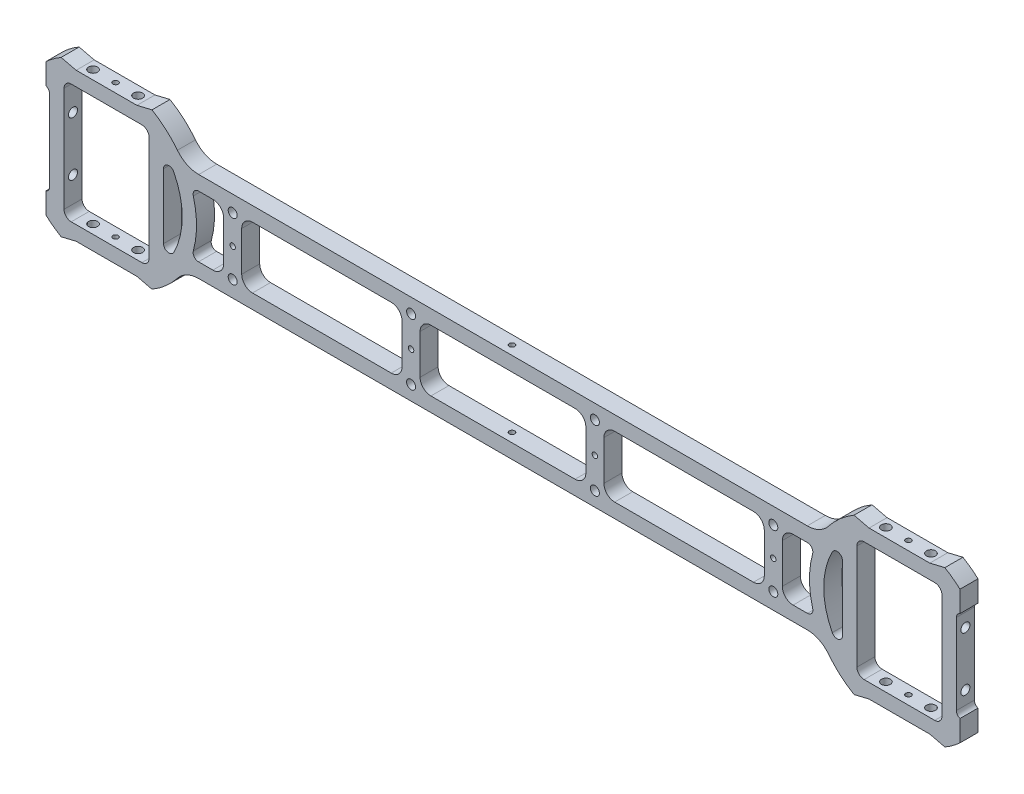
from build123d import *
from build123d.topology import SkipClean

# Parameters (mm, degrees)
SKETCH_1_R              = 2.5
SKETCH_1_W              = 47.2
SKETCH_1_H              = 66.2
SKETCH_1_R_2            = 1.5
SKETCH_1_W_2            = 89
SKETCH_1_H_2            = 34
EXTRUDE_1_DEPTH         = 10
FILLET_1_R              = 4
FILLET_4_R              = 6
FILLET_7_R              = 3
FILLET_8_R              = 3
SKETCH_2_R              = 2.5
SKETCH_2_R_2            = 1.5
CUT_EXTRUDE_1_DEPTH     = 258.430709124
SKETCH_3_R              = 2.5
CUT_EXTRUDE_2_DEPTH     = 30
SKETCH_4_R              = 1.5
CUT_EXTRUDE_3_DEPTH     = 263.774751451
FILLET_10_R             = 15
FILLET_11_R             = 3
FILLET_1_OF_MIRROR_1_R  = 4
FILLET_4_OF_MIRROR_1_R  = 6
FILLET_7_OF_MIRROR_1_R  = 3
FILLET_8_OF_MIRROR_1_R  = 3
FILLET_10_OF_MIRROR_1_R = 15
FILLET_11_OF_MIRROR_1_R = 3
SKETCH_5_R              = 2.5
EXTRUDE_2_DEPTH         = 10
SKETCH_6_R              = 2.5
CUT_EXTRUDE_4_DEPTH     = 10
EXTRUDE_3_DEPTH         = 10
SKETCH_8_R              = 2.5
CUT_EXTRUDE_5_DEPTH     = 10


with BuildPart() as part:
    # 草图1 → 凸台-拉伸1 (new body)
    with BuildSketch(Plane.XY):
        with BuildLine():
            Line((-46, -17), (-46, 17))
            Line((-46, 17), (0, 17))
            Line((0, 17), (0, 25))
            Line((0, 25), (-176.776511015, 25))
            ThreePointArc((-176.776511015, 25), (-184.605554742, 35.220778596), (-194.787701414, 43.1))
            Line((-194.787701414, 43.1), (-203.153806011, 41.1))
            Line((-203.153806011, 41.1), (-236.846193989, 41.1))
            Line((-236.846193989, 41.1), (-245.212298586, 43.1))
            ThreePointArc((-245.212298586, 43.1), (-249.567187761, 40.23743789), (-253.6, 36.936567247))
            Line((-253.6, 36.936567247), (-253.6, 25.2))
            ThreePointArc((-253.6, 25.2), (-252.623320065, 26.452201949), (-251.6, 27.666586345))
            Line((-251.6, 27.666586345), (-251.6, -27.666586345))
            ThreePointArc((-251.6, -27.666586345), (-252.623320065, -26.452201949), (-253.6, -25.2))
            Line((-253.6, -25.2), (-253.6, -36.936567247))
            ThreePointArc((-253.6, -36.936567247), (-249.567187761, -40.23743789), (-245.212298586, -43.1))
            Line((-245.212298586, -43.1), (-236.846193989, -41.1))
            Line((-236.846193989, -41.1), (-203.153806011, -41.1))
            Line((-203.153806011, -41.1), (-194.787701414, -43.1))
            ThreePointArc((-194.787701414, -43.1), (-184.605554742, -35.220778596), (-176.776511015, -25))
            Line((-176.776511015, -25), (0, -25))
            Line((0, -25), (0, -17))
            Line((0, -17), (-46, -17))
        make_face()
        with Locations((-51, 17)):
            Circle(SKETCH_1_R, mode=Mode.SUBTRACT)
        with Locations((-150, -19)):
            Circle(SKETCH_1_R, mode=Mode.SUBTRACT)
        with BuildLine():
            Line((-188.4, -27.666586345), (-188.4, 27.666586345))
            ThreePointArc((-188.4, 27.666586345), (-178, 0), (-188.4, -27.666586345))
        make_face(mode=Mode.SUBTRACT)
        with BuildLine():
            Line((-155, -17), (-173.050346114, -17))
            ThreePointArc((-173.050346114, -17), (-170.067345354, 0), (-173.050346114, 17))
            Line((-173.050346114, 17), (-155, 17))
            Line((-155, 17), (-155, -17))
        make_face(mode=Mode.SUBTRACT)
        with Locations((-51, -17)):
            Circle(SKETCH_1_R, mode=Mode.SUBTRACT)
        with Locations((-220, 0)):
            Rectangle(SKETCH_1_W, SKETCH_1_H, mode=Mode.SUBTRACT)
        with Locations((-150, 0)):
            Circle(SKETCH_1_R_2, mode=Mode.SUBTRACT)
        with Locations((-150, 19)):
            Circle(SKETCH_1_R, mode=Mode.SUBTRACT)
        with Locations((-100.5, 0)):
            Rectangle(SKETCH_1_W_2, SKETCH_1_H_2, mode=Mode.SUBTRACT)
        with Locations((-51, 0)):
            Circle(SKETCH_1_R_2, mode=Mode.SUBTRACT)
    extrude_1 = extrude(amount=EXTRUDE_1_DEPTH)

    # 圆角1
    fillet_1_edges = [part.edges().sort_by_distance(p)[0] for p in [
        (-196.4, 33.1, 5),
        (-243.6, 33.1, 5),
        (-243.6, -33.1, 5),
        (-196.4, -33.1, 5),
    ]]
    fillet(fillet_1_edges, radius=FILLET_1_R)

    # 圆角4
    fillet_4_edges = [part.edges().sort_by_distance(p)[0] for p in [
        (-155, -17, 5),
        (-155, 17, 5),
        (-145, 17, 5),
        (-145, -17, 5),
        (-56, -17, 5),
        (-56, 17, 5),
        (-46, -17, 5),
        (-46, 17, 5),
    ]]
    fillet(fillet_4_edges, radius=FILLET_4_R)

    # 圆角7
    # the kernel refuses this fillet: 3 mm, written as the material it adds along each edge
    with BuildSketch(Plane(origin=(-251.6, -27.666586345, 0), x_dir=(-0.6298143321188929, 0.7767457158283095, 0), z_dir=(0, 0, 1))) as fillet_7_piece_1:
        with BuildLine():
            CenterArc((6.002322024, -1.004638225), FILLET_7_R, 160.43479501, 70.528779366)
            Line((4.112879028, -3.334875372), (4.075090168, -3.381480115))
            Line((4.075090168, -3.381480115), (-0.03778886, -0.046604743))
            Line((-0.03778886, -0.046604743), (-0.002268242, 0.05995711))
            ThreePointArc((-0.002268242, 0.05995711), (1.58776952, 0.090022779), (3.119003381, 0.020092764))
            Line((3.119003381, 0.020092764), (3.175539041, 0))
        make_face()
    extrude(amount=10)
    with BuildSketch(Plane(origin=(-251.6, 27.666586345, 0), x_dir=(0, -1, 0), z_dir=(0, 0, 1))) as fillet_7_piece_2:
        with BuildLine():
            CenterArc((5.29501347, -3), FILLET_7_R, 90, 70.528779366)
            Line((2.466586345, -2), (2.410017803, -1.98))
            ThreePointArc((2.410017803, -1.98), (1.176595536, -1.069924808), (-0.039523695, -0.045142857))
            Line((-0.039523695, -0.045142857), (0, 0.06))
            Line((0, 0.06), (5.29501347, 0.06))
            Line((5.29501347, 0.06), (5.29501347, 0))
        make_face()
    extrude(amount=10)

    # 圆角8
    fillet_8_edges = [part.edges().sort_by_distance(p)[0] for p in [
        (-188.4, 27.666586345, 5),
        (-188.4, -27.666586345, 5),
    ]]
    fillet(fillet_8_edges, radius=FILLET_8_R)

    # 草图2 → 切除-拉伸1 (cut, symmetric)
    with BuildSketch(Plane(origin=(0, 0, 0), x_dir=(1, 0, 0), z_dir=(0, 1, 0))):
        with Locations(Location((-232.5, -5, 0), (0, 0, 270))):
            Circle(SKETCH_2_R)
        with Locations(Location((-207.5, -5, 0), (0, 0, 270))):
            Circle(SKETCH_2_R)
        with Locations(Location((-220, -5, 0), (0, 0, 270))):
            Circle(SKETCH_2_R_2)
    cut_extrude_1 = extrude(amount=CUT_EXTRUDE_1_DEPTH, both=True, mode=Mode.SUBTRACT)

    # 草图3 → 切除-拉伸2 (cut)
    with BuildSketch(Plane(origin=(-243.6, 0, 0), x_dir=(0, 0, -1), z_dir=(1, 0, 0))):
        with Locations((-5, 15)):
            Circle(SKETCH_3_R)
        with Locations((-5, -15)):
            Circle(SKETCH_3_R)
    cut_extrude_2 = extrude(amount=-CUT_EXTRUDE_2_DEPTH, mode=Mode.SUBTRACT)

    # 草图4 → 切除-拉伸3 (cut, through all)
    with BuildSketch(Plane(origin=(0, 25, 0), x_dir=(1, 0, 0), z_dir=(0, 1, 0))):
        with Locations((0, -5)):
            Circle(SKETCH_4_R)
    cut_extrude_3 = extrude(amount=-CUT_EXTRUDE_3_DEPTH, mode=Mode.SUBTRACT)

    # 圆角10
    fillet_10_edges = [part.edges().sort_by_distance(p)[0] for p in [
        (-176.776511015, -25, 5),
        (-176.776511015, 25, 5),
    ]]
    fillet(fillet_10_edges, radius=FILLET_10_R)

    # 圆角11
    fillet_11_edges = [part.edges().sort_by_distance(p)[0] for p in [
        (-173.050346114, 17, 5),
        (-173.050346114, -17, 5),
    ]]
    fillet(fillet_11_edges, radius=FILLET_11_R)

    # 镜向1: 凸台-拉伸1, 切除-拉伸1, 切除-拉伸2, 切除-拉伸3 across plane
    with SkipClean():  # the faces are left unmerged after this step: merging them gives an invalid solid
        add(extrude_1.mirror(Plane(origin=(0, 0, 10), x_dir=(0, 0, 1), z_dir=(1, 0, 0))))
        add(cut_extrude_1.mirror(Plane(origin=(0, 0, 10), x_dir=(0, 0, 1), z_dir=(1, 0, 0))), mode=Mode.SUBTRACT)
        add(cut_extrude_2.mirror(Plane(origin=(0, 0, 10), x_dir=(0, 0, 1), z_dir=(1, 0, 0))), mode=Mode.SUBTRACT)
        add(cut_extrude_3.mirror(Plane(origin=(0, 0, 10), x_dir=(0, 0, 1), z_dir=(1, 0, 0))), mode=Mode.SUBTRACT)

    # 圆角1 of 镜向1
    fillet_1_of_mirror_1_edges = [part.edges().sort_by_distance(p)[0] for p in [
        (196.4, 33.1, 5),
        (243.6, 33.1, 5),
        (243.6, -33.1, 5),
        (196.4, -33.1, 5),
    ]]
    fillet(fillet_1_of_mirror_1_edges, radius=FILLET_1_OF_MIRROR_1_R)

    # 圆角4 of 镜向1
    fillet_4_of_mirror_1_edges = [part.edges().sort_by_distance(p)[0] for p in [
        (155, -17, 5),
        (155, 17, 5),
        (145, 17, 5),
        (145, -17, 5),
        (56, -17, 5),
        (56, 17, 5),
        (46, -17, 5),
        (46, 17, 5),
    ]]
    fillet(fillet_4_of_mirror_1_edges, radius=FILLET_4_OF_MIRROR_1_R)

    # 圆角7 of 镜向1
    # the kernel refuses this fillet: 3 mm, written as the material it adds along each edge
    with BuildSketch(Plane(origin=(251.6, -27.666586345, 0), x_dir=(0, 1, 0), z_dir=(0, 0, 1))) as fillet_7_of_mirror_1_piece_1:
        with BuildLine():
            CenterArc((5.29501347, -3), FILLET_7_OF_MIRROR_1_R, 90, 70.528779366)
            Line((2.466586345, -2), (2.410017803, -1.98))
            ThreePointArc((2.410017803, -1.98), (1.176595536, -1.069924808), (-0.039523695, -0.045142857))
            Line((-0.039523695, -0.045142857), (0, 0.06))
            Line((0, 0.06), (5.29501347, 0.06))
            Line((5.29501347, 0.06), (5.29501347, 0))
        make_face()
    extrude(amount=10)
    with BuildSketch(Plane(origin=(251.6, 27.666586345, 0), x_dir=(0.6298143321188939, -0.7767457158283085, 0), z_dir=(0, 0, 1))) as fillet_7_of_mirror_1_piece_2:
        with BuildLine():
            CenterArc((6.002322024, -1.004638225), FILLET_7_OF_MIRROR_1_R, 160.43479501, 70.528779366)
            Line((4.112879028, -3.334875372), (4.075090168, -3.381480115))
            Line((4.075090168, -3.381480115), (-0.03778886, -0.046604743))
            Line((-0.03778886, -0.046604743), (-0.002268242, 0.05995711))
            ThreePointArc((-0.002268242, 0.05995711), (1.58776952, 0.090022779), (3.119003381, 0.020092764))
            Line((3.119003381, 0.020092764), (3.175539041, 0))
        make_face()
    extrude(amount=10)

    # 圆角8 of 镜向1
    fillet_8_of_mirror_1_edges = [part.edges().sort_by_distance(p)[0] for p in [
        (188.4, 27.666586345, 5),
        (188.4, -27.666586345, 5),
    ]]
    fillet(fillet_8_of_mirror_1_edges, radius=FILLET_8_OF_MIRROR_1_R)

    # 圆角10 of 镜向1
    fillet_10_of_mirror_1_edges = [part.edges().sort_by_distance(p)[0] for p in [
        (176.776511015, -25, 5),
        (176.776511015, 25, 5),
    ]]
    fillet(fillet_10_of_mirror_1_edges, radius=FILLET_10_OF_MIRROR_1_R)

    # 圆角11 of 镜向1
    fillet_11_of_mirror_1_edges = [part.edges().sort_by_distance(p)[0] for p in [
        (173.050346114, 17, 5),
        (173.050346114, -17, 5),
    ]]
    fillet(fillet_11_of_mirror_1_edges, radius=FILLET_11_OF_MIRROR_1_R)

    # 草图5 → 凸台-拉伸2 (add)
    with BuildSketch(Plane(origin=(0, 0, 0), x_dir=(-1, 0, 0), z_dir=(0, 0, -1))):
        with Locations((150, 19)):
            Circle(SKETCH_5_R)
        with Locations((150, -19)):
            Circle(SKETCH_5_R)
        with Locations((-150, -19)):
            Circle(SKETCH_5_R)
        with Locations((-150, 19)):
            Circle(SKETCH_5_R)
    extrude(amount=-EXTRUDE_2_DEPTH)

    # 草图6 → 切除-拉伸4 (cut)
    with BuildSketch(Plane(origin=(0, 0, 0), x_dir=(-1, 0, 0), z_dir=(0, 0, -1))):
        with Locations(Location((-150, 16, 0), (0, 0, 90))):
            Circle(SKETCH_6_R)
        with Locations(Location((-150, -16, 0), (0, 0, 270))):
            Circle(SKETCH_6_R)
        with Locations((48, -16)):
            Circle(SKETCH_6_R)
        with Locations((48, 16)):
            Circle(SKETCH_6_R)
    extrude(amount=-CUT_EXTRUDE_4_DEPTH, mode=Mode.SUBTRACT)

    # 草图7 → 凸台-拉伸3 (add)
    with BuildSketch(Plane(origin=(0, 0, 0), x_dir=(-1, 0, 0), z_dir=(0, 0, -1))):
        with BuildLine():
            ThreePointArc((48.887627564, 18.337117307), (45.628291755, 15.209430585), (50.112372436, 14.662882693))
            ThreePointArc((50.112372436, 14.662882693), (48.628291755, 16.209430585), (48.887627564, 18.337117307))
        make_face()
        with BuildLine():
            ThreePointArc((50.112372436, -14.662882693), (48.628291755, -16.209430585), (48.887627564, -18.337117307))
            ThreePointArc((48.887627564, -18.337117307), (45.628291755, -15.209430585), (50.112372436, -14.662882693))
        make_face()
    extrude(amount=-EXTRUDE_3_DEPTH)

    # 草图8 → 切除-拉伸5 (cut)
    with BuildSketch(Plane(origin=(0, 0, 0), x_dir=(-1, 0, 0), z_dir=(0, 0, -1))):
        with Locations(Location((-150, 16, 0), (0, 0, 90))):
            Circle(SKETCH_8_R)
        with Locations(Location((-150, -16, 0), (0, 0, 270))):
            Circle(SKETCH_8_R)
        with Locations(Location((150, -16, 0), (0, 0, 270))):
            Circle(SKETCH_8_R)
        with Locations(Location((150, 16, 0), (0, 0, 270))):
            Circle(SKETCH_8_R)
    extrude(amount=-CUT_EXTRUDE_5_DEPTH, mode=Mode.SUBTRACT)


solid = part.part
